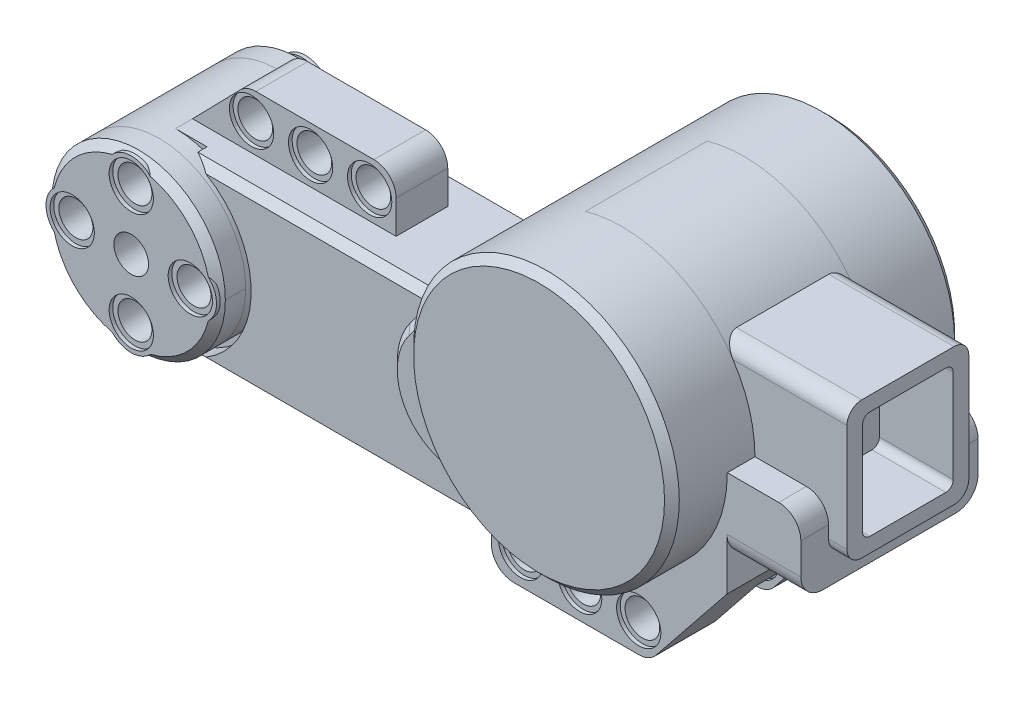
from build123d import *
from build123d.topology import SkipClean

# Parameters (mm, degrees)
BOSS_EXTRUDE1_DEPTH      = 16.1
SKETCH2_R                = 12.5
CUT_EXTRUDE1_DEPTH       = 2.25
CUT_EXTRUDE2_DEPTH       = 2.25
SKETCH5_R                = 2.35
BOSS_EXTRUDE2_DEPTH      = 20
SKETCH6_R                = 18
BOSS_EXTRUDE3_DEPTH      = 7.8
BOSS_EXTRUDE4_START      = 4
SKETCH7_R                = 2.35
BOSS_EXTRUDE4_DEPTH      = 4
BOSS_EXTRUDE5_START      = 7.5
SKETCH8_R                = 18
BOSS_EXTRUDE5_DEPTH      = 7.5
FILLET1_R                = 9
FILLET2_R                = 3
BOSS_EXTRUDE6_DEPTH      = 16.1
FILLET3_R                = 3
CHAMFER1_SIZE            = 1
FILLET4_R                = 3
FILLET5_R                = 3
SKETCH10_W               = 33.097936897
SKETCH10_H               = 7.92
CUT_EXTRUDE3_DEPTH       = 8.1
BOSS_EXTRUDE7_REACH      = 117.391
BOSS_EXTRUDE7_END_RADIUS = 18
BOSS_EXTRUDE8_START      = 2.5
BOSS_EXTRUDE8_DEPTH      = 2.5
SKETCH13_W               = 12.28
SKETCH13_H               = 14.6
CUT_EXTRUDE5_DEPTH       = 10
FILLET6_R                = 1
SKETCH14_R               = 11.75
BOSS_EXTRUDE9_DEPTH      = 6
BOSS_EXTRUDE10_START     = 6
SKETCH15_R               = 11.75
BOSS_EXTRUDE10_DEPTH     = 6
CHAMFER2_SIZE            = 1
SKETCH16_R               = 2.35
CUT_EXTRUDE6_DEPTH       = 109.324095823
SKETCH17_R               = 2.3
CUT_EXTRUDE7_DEPTH       = 5
SKETCH18_R               = 3
CUT_EXTRUDE8_DEPTH       = 0.5
SKETCH19_R               = 3.55
SKETCH19_R_2             = 3
BOSS_EXTRUDE11_DEPTH     = 0.5
BOSS_EXTRUDE12_START     = -0.5
SKETCH20_R               = 3.55
SKETCH20_R_2             = 3
BOSS_EXTRUDE12_DEPTH     = 0.5
CUT_EXTRUDE9_START       = -0.5
SKETCH21_R               = 3
CUT_EXTRUDE9_DEPTH       = 0.5
CUT_EXTRUDE10_START      = -5
SKETCH22_R               = 2.3
CUT_EXTRUDE10_DEPTH      = 5
SKETCH23_R               = 2.35
BOSS_EXTRUDE13_DEPTH     = 3.5
BOSS_EXTRUDE14_START     = 3.5
SKETCH24_R               = 2.35
BOSS_EXTRUDE14_DEPTH     = 3.5
SKETCH25_R               = 3
CUT_EXTRUDE11_DEPTH      = 0.5
CUT_EXTRUDE12_START      = -0.5
SKETCH26_R               = 3
CUT_EXTRUDE12_DEPTH      = 0.5
FILLET7_R                = 3
SKETCH27_R               = 3
CUT_EXTRUDE13_DEPTH      = 0.5
CUT_EXTRUDE14_START      = -0.5
SKETCH28_R               = 3
CUT_EXTRUDE14_DEPTH      = 0.5
SKETCH29_R               = 3
CUT_EXTRUDE15_DEPTH      = 0.5
CUT_EXTRUDE16_START      = -0.5
SKETCH30_R               = 3
CUT_EXTRUDE16_DEPTH      = 0.5


with BuildPart() as part:
    # Sketch1 → Boss-Extrude1 (new body)
    with BuildSketch(Plane.XY):
        with BuildLine():
            Line((0, 0), (44, 0))
            Line((44, 0), (44, 23.5))
            Line((44, 23.5), (0, 23.5))
            ThreePointArc((0, 23.5), (-11.75, 11.75), (0, 0))
        make_face()
    extrude(amount=BOSS_EXTRUDE1_DEPTH)

    # Sketch2 → Cut-Extrude1 (cut)
    with BuildSketch(Plane.XY.offset(16.1)):
        with Locations((0, 11.75)):
            Circle(SKETCH2_R)
    extrude(amount=-CUT_EXTRUDE1_DEPTH, mode=Mode.SUBTRACT)

    # Sketch3 → Cut-Extrude2 (cut)
    with BuildSketch(Plane(origin=(0, 0, 0), x_dir=(-1, 0, 0), z_dir=(0, 0, -1))):
        with BuildLine():
            Line((-4.264680527, 0), (0, 0))
            ThreePointArc((0, 0), (11.75, 11.75), (0, 23.5))
            Line((0, 23.5), (-4.264680527, 23.5))
            ThreePointArc((-4.264680527, 23.5), (-12.5, 11.75), (-4.264680527, 0))
        make_face()
    extrude(amount=-CUT_EXTRUDE2_DEPTH, mode=Mode.SUBTRACT)

    # Sketch5 → Boss-Extrude2 (add)
    with BuildSketch(Plane.XY.offset(16.1)):
        with BuildLine():
            Line((35.5, 7.5), (49.045, 7.5))
            Line((49.045, 7.5), (49.045, -0.6))
            Line((49.045, -0.6), (70.455, -0.6))
            Line((70.455, -0.6), (76.955, 7.5))
            Line((76.955, 7.5), (80.967345679, 12.5))
            Line((80.967345679, 12.5), (80.967345679, 16.5))
            Line((80.967345679, 16.5), (90.967345679, 16.5))
            Line((90.967345679, 16.5), (90.967345679, 26.75))
            Line((90.967345679, 26.75), (81, 26.75))
            ThreePointArc((81, 26.75), (68.611740624, 43.852875991), (48.499070314, 37.414100443))
            Line((48.499070314, 37.414100443), (26.5, 7.5))
            Line((26.5, 7.5), (35.5, 7.5))
        make_face()
        with Locations((61, 3.45)):
            Circle(SKETCH5_R, mode=Mode.SUBTRACT)
        with Locations((69, 3.45)):
            Circle(SKETCH5_R, mode=Mode.SUBTRACT)
        with Locations((53, 3.45)):
            Circle(SKETCH5_R, mode=Mode.SUBTRACT)
    extrude(amount=-BOSS_EXTRUDE2_DEPTH)

    # Sketch6 → Boss-Extrude3 (add)
    with BuildSketch(Plane(origin=(0, 0, -3.9), x_dir=(-1, 0, 0), z_dir=(0, 0, -1))):
        with Locations(Location((-63, 26.75, 0), (0, 0, 180))):
            Circle(SKETCH6_R)
    extrude(amount=BOSS_EXTRUDE3_DEPTH)

    # Sketch7 → Boss-Extrude4 (add)
    with BuildSketch(Plane.XY.offset(16.1).offset(BOSS_EXTRUDE4_START)):
        with BuildLine():
            Line((90.967345679, 26.75), (81, 26.75))
            ThreePointArc((81, 26.75), (68.611740624, 43.852875991), (48.499070314, 37.414100443))
            Line((48.499070314, 37.414100443), (26.5, 7.5))
            Line((26.5, 7.5), (49.045, 7.5))
            Line((49.045, 7.5), (49.045, -0.6))
            Line((49.045, -0.6), (70.455, -0.6))
            Line((70.455, -0.6), (80.967345679, 12.5))
            Line((80.967345679, 12.5), (80.967345679, 16.5))
            Line((80.967345679, 16.5), (90.967345679, 16.5))
            Line((90.967345679, 16.5), (90.967345679, 26.75))
        make_face()
        with Locations((69, 3.45)):
            Circle(SKETCH7_R, mode=Mode.SUBTRACT)
        with Locations((61, 3.45)):
            Circle(SKETCH7_R, mode=Mode.SUBTRACT)
        with Locations((53, 3.45)):
            Circle(SKETCH7_R, mode=Mode.SUBTRACT)
    extrude(amount=-BOSS_EXTRUDE4_DEPTH)

    # Sketch8 → Boss-Extrude5 (add)
    with BuildSketch(Plane.XY.offset(20.1).offset(BOSS_EXTRUDE5_START)):
        with Locations((63, 26.75)):
            Circle(SKETCH8_R)
    extrude(amount=-BOSS_EXTRUDE5_DEPTH)

    # Fillet1
    fillet1_edges = [part.edges().sort_by_distance(p)[0] for p in [
        (26.5, 7.5, 18.1),
    ]]
    fillet(fillet1_edges, radius=FILLET1_R)

    # Fillet2
    fillet2_edges = [part.edges().sort_by_distance(p)[0] for p in [
        (70.455, -0.6, 6.1),
        (49.045, -0.6, 6.1),
    ]]
    fillet(fillet2_edges, radius=FILLET2_R)

    # Sketch9 → Boss-Extrude6 (add)
    with BuildSketch(Plane(origin=(0, 0, 0), x_dir=(-1, 0, 0), z_dir=(0, 0, -1))):
        Polygon((-44, 0), (-49.045, 7.5), (-44, 9.048717535), align=None)
    extrude(amount=-BOSS_EXTRUDE6_DEPTH)

    # Fillet3
    fillet3_edges = [part.edges().sort_by_distance(p)[0] for p in [
        (44, 0, 8.05),
    ]]
    fillet(fillet3_edges, radius=FILLET3_R)

    # Chamfer1
    # the kernel refuses this chamfer: 1 mm, written as the material it takes off along each edge
    with BuildSketch(Plane(origin=(63, 26.75, 27.6), x_dir=(1, 0, 0), z_dir=(0, -1, 0))) as chamfer1_piece_1:
        Polygon((18, -CHAMFER1_SIZE), (18 - CHAMFER1_SIZE, 0), (18, 0), align=None)
    revolve(axis=Axis((63, 26.75, 27.6), (0, 0, 1)), mode=Mode.SUBTRACT)
    with BuildSketch(Plane(origin=(44.290369968, 7.5, -3.9), x_dir=(0, 0.9996219169112968, -0.02749587661058651), z_dir=(1, 0, 0))) as chamfer1_piece_2:
        Polygon((CHAMFER1_SIZE * 0.999621916911, CHAMFER1_SIZE * 0.0274958766106), (-CHAMFER1_SIZE * 0.0274958766106, CHAMFER1_SIZE * 0.999621916911), (0, 0), align=None)
    extrude(amount=4.754630032, mode=Mode.SUBTRACT)
    with BuildSketch(Plane(origin=(44.290369968, 7.5, 20.1), x_dir=(0, 0.9996219169112968, 0.027495876610585647), z_dir=(1, 0, 0))) as chamfer1_piece_3:
        Polygon((CHAMFER1_SIZE * 0.999621916911, -CHAMFER1_SIZE * 0.0274958766106), (-CHAMFER1_SIZE * 0.0274958766106, -CHAMFER1_SIZE * 0.999621916911), (0, 0), align=None)
    extrude(amount=4.754630032, mode=Mode.SUBTRACT)
    with BuildSketch(Plane(origin=(44.290369968, 16.5, -3.9), x_dir=(-0.8056072047544376, 0.5924500245993257, 0), z_dir=(0.5924500245993257, 0.8056072047544376, 0))) as chamfer1_piece_4:
        Polygon((9 - CHAMFER1_SIZE, 0), (9, CHAMFER1_SIZE), (9, 0), align=None)
    revolve(axis=Axis((44.290369968, 16.5, -3.9), (0, 0, 1)), revolution_arc=126.331062822, mode=Mode.SUBTRACT)
    with BuildSketch(Plane(origin=(44.290369968, 16.5, 20.1), x_dir=(-0.8056072047544383, 0.5924500245993248, 0), z_dir=(0.5924500245993248, 0.8056072047544383, 0))) as chamfer1_piece_5:
        Polygon((9 - CHAMFER1_SIZE, 0), (9, -CHAMFER1_SIZE), (9, 0), align=None)
    revolve(axis=Axis((44.290369968, 16.5, 20.1), (0, 0, 1)), revolution_arc=126.331062822, mode=Mode.SUBTRACT)
    with BuildSketch(Plane(origin=(1.692997539, 0, 16.1), x_dir=(0, 0.9996219169112968, 0.02749587661058563), z_dir=(1, 0, 0)), Plane(origin=(1.692997539, 0, 0), x_dir=(0, -0.027495876610586372, 0.9996219169112968), z_dir=(1, 0, 0))) as chamfer1_piece_6:
        Polygon((CHAMFER1_SIZE * 0.999621916911, -CHAMFER1_SIZE * 0.0274958766106), (-CHAMFER1_SIZE * 0.0274958766106, -CHAMFER1_SIZE * 0.999621916911), (0, 0), align=None)
    extrude(amount=40.709435562, mode=Mode.SUBTRACT)
    with BuildSketch(Plane(origin=(44.891669299, 1.325573784, 0), x_dir=(0.02281457711602184, -0.015346605540044031, 0.9996219169112968), z_dir=(0.5581420718965207, 0.829745399251517, 0))) as chamfer1_piece_7_section:
        Polygon((CHAMFER1_SIZE * 0.999621916911, -CHAMFER1_SIZE * 0.0274958766106), (-CHAMFER1_SIZE * 0.0274958766106, -CHAMFER1_SIZE * 0.999621916911), (0, 0), align=None)
    chamfer1_piece_7 = extrude(amount=10.013033336, mode=Mode.PRIVATE)
    chamfer1_piece_7 = split(chamfer1_piece_7, bisect_by=Plane(origin=(46.990956346, 7.5, 0.346010194), z_dir=(0, -1, 0)), keep=Keep.TOP, mode=Mode.PRIVATE)
    add(chamfer1_piece_7, mode=Mode.SUBTRACT)
    with BuildSketch(Plane(origin=(44.891669299, 1.325573784, 16.1), x_dir=(0.02281457711602186, -0.015346605540044045, -0.9996219169112968), z_dir=(0.5581420718965207, 0.829745399251517, 0))) as chamfer1_piece_8_section:
        Polygon((CHAMFER1_SIZE * 0.999621916911, CHAMFER1_SIZE * 0.0274958766106), (-CHAMFER1_SIZE * 0.0274958766106, CHAMFER1_SIZE * 0.999621916911), (0, 0), align=None)
    chamfer1_piece_8 = extrude(amount=10.013033336, mode=Mode.PRIVATE)
    chamfer1_piece_8 = split(chamfer1_piece_8, bisect_by=Plane(origin=(46.990956346, 7.5, 15.753989806), z_dir=(0, -1, 0)), keep=Keep.TOP, mode=Mode.PRIVATE)
    add(chamfer1_piece_8, mode=Mode.SUBTRACT)
    with BuildSketch(Plane(origin=(42.402433101, 3, 0), x_dir=(0.8297453992515168, -0.5581420718965208, 0), z_dir=(0.5581420718965208, 0.8297453992515168, 0))) as chamfer1_piece_9:
        Polygon((3, -CHAMFER1_SIZE), (3 - CHAMFER1_SIZE, 0), (3, 0), align=None)
    revolve(axis=Axis((42.402433101, 3, 0), (0, 0, -1)), revolution_arc=56.072593229, mode=Mode.SUBTRACT)
    with BuildSketch(Plane(origin=(42.402433101, 3, 16.1), x_dir=(0.8297453992515168, -0.5581420718965208, 0), z_dir=(0.5581420718965208, 0.8297453992515168, 0))) as chamfer1_piece_10:
        Polygon((3 - CHAMFER1_SIZE, 0), (3, CHAMFER1_SIZE), (3, 0), align=None)
    revolve(axis=Axis((42.402433101, 3, 16.1), (0, 0, -1)), revolution_arc=56.072593229, mode=Mode.SUBTRACT)
    with BuildSketch(Plane(origin=(40.83821181, 23.5, 0), x_dir=(0, 0.02749587661058563, 0.9996219169112968), z_dir=(-1, 0, 0))) as chamfer1_piece_11_section:
        Polygon((CHAMFER1_SIZE * 0.999621916911, -CHAMFER1_SIZE * 0.0274958766106), (-CHAMFER1_SIZE * 0.0274958766106, -CHAMFER1_SIZE * 0.999621916911), (0, 0), align=None)
    chamfer1_piece_11 = extrude(amount=39.14521427, mode=Mode.PRIVATE)
    chamfer1_piece_11 = split(chamfer1_piece_11, bisect_by=Plane(origin=(32.237492619, 15.301781077, 0.335802293), z_dir=(-0.8056072047544383, 0.5924500245993248, 0)), keep=Keep.TOP, mode=Mode.PRIVATE)
    add(chamfer1_piece_11, mode=Mode.SUBTRACT)
    with BuildSketch(Plane(origin=(40.83821181, 23.5, 16.1), x_dir=(0, -0.9996219169112968, 0.027495876610585647), z_dir=(-1, 0, 0))) as chamfer1_piece_12_section:
        Polygon((CHAMFER1_SIZE * 0.999621916911, -CHAMFER1_SIZE * 0.0274958766106), (-CHAMFER1_SIZE * 0.0274958766106, -CHAMFER1_SIZE * 0.999621916911), (0, 0), align=None)
    chamfer1_piece_12 = extrude(amount=39.14521427, mode=Mode.PRIVATE)
    chamfer1_piece_12 = split(chamfer1_piece_12, bisect_by=Plane(origin=(32.237492621, 15.301781079, 15.764197707), z_dir=(-0.8056072047544383, 0.5924500245993248, 0)), keep=Keep.TOP, mode=Mode.PRIVATE)
    add(chamfer1_piece_12, mode=Mode.SUBTRACT)
    with BuildSketch(Plane(origin=(50.022663964, 39.485866786, -3.9), x_dir=(-0.0221508762985308, 0.016289932774324382, 0.9996219169112965), z_dir=(-0.5924500245993248, -0.8056072047544383, 0))) as chamfer1_piece_13_section:
        Polygon((CHAMFER1_SIZE * 0.999621916911, -CHAMFER1_SIZE * 0.0274958766106), (-CHAMFER1_SIZE * 0.0274958766106, -CHAMFER1_SIZE * 0.999621916911), (0, 0), align=None)
    chamfer1_piece_13 = extrude(amount=21.913677609, mode=Mode.PRIVATE)
    chamfer1_piece_13 = chamfer1_piece_13 - Plane(origin=(63, 26.75, -3.548356568), x_dir=(1, 0, 0), z_dir=(0, 0, 1)) * Cylinder(18, 48, mode=Mode.PRIVATE)
    add(chamfer1_piece_13, mode=Mode.SUBTRACT)
    with BuildSketch(Plane(origin=(63, 26.75, -11.7), x_dir=(1, 0, 0), z_dir=(0, 1, 0))) as chamfer1_piece_14:
        Polygon((18, -CHAMFER1_SIZE), (18 - CHAMFER1_SIZE, 0), (18, 0), align=None)
    revolve(axis=Axis((63, 26.75, -11.7), (0, 0, -1)), mode=Mode.SUBTRACT)
    with BuildSketch(Plane(origin=(50.022663964, 39.485866786, 20.1), x_dir=(-0.022150876298526342, 0.016289932774321097, -0.9996219169112968), z_dir=(-0.5924500245993248, -0.8056072047544384, 0))) as chamfer1_piece_15_section:
        Polygon((CHAMFER1_SIZE * 0.999621916911, CHAMFER1_SIZE * 0.0274958766106), (-CHAMFER1_SIZE * 0.0274958766106, CHAMFER1_SIZE * 0.999621916911), (0, 0), align=None)
    chamfer1_piece_15 = extrude(amount=21.913677609, mode=Mode.PRIVATE)
    chamfer1_piece_15 = chamfer1_piece_15 - Plane(origin=(63, 26.75, 19.748356568), x_dir=(1, 0, 0), z_dir=(0, 0, 1)) * Cylinder(18, 48, mode=Mode.PRIVATE)
    add(chamfer1_piece_15, mode=Mode.SUBTRACT)

    # Fillet4
    fillet4_edges = [part.edges().sort_by_distance(p)[0] for p in [
        (90.967345679, 26.75, 8.1),
    ]]
    fillet(fillet4_edges, radius=FILLET4_R)

    # Fillet5
    fillet5_edges = [part.edges().sort_by_distance(p)[0] for p in [
        (85.967345679, 16.5, -3.9),
        (85.967345679, 16.5, 20.1),
    ]]
    fillet(fillet5_edges, radius=FILLET5_R)

    # Sketch10 → Cut-Extrude3 (cut)
    with BuildSketch(Plane.XZ.offset(0.6)):
        with Locations((65.593968448, 8.05)):
            Rectangle(SKETCH10_W, SKETCH10_H)
    extrude(amount=-CUT_EXTRUDE3_DEPTH, mode=Mode.SUBTRACT)

    # Boss-Extrude7: up to this cylinder (the profile starts outside it)
    boss_extrude7_end = Plane(origin=(63, 26.75, 8.1), z_dir=(0, 0, 1)) * Cylinder(BOSS_EXTRUDE7_END_RADIUS, 271.782, mode=Mode.PRIVATE)
    # Sketch11 → Boss-Extrude7 (add, up to the surface)
    with BuildSketch(Plane(origin=(90.967345679, 0, 0), x_dir=(0, 0, -1), z_dir=(1, 0, 0)), mode=Mode.PRIVATE) as boss_extrude7_sk1:
        with BuildLine():
            Line((-14.35, 20.1), (-1.85, 20.1))
            ThreePointArc((-1.85, 20.1), (-0.435786438, 20.685786438), (0.15, 22.1))
            Line((0.15, 22.1), (0.15, 36.66))
            ThreePointArc((0.15, 36.66), (-0.435786438, 38.074213562), (-1.85, 38.66))
            Line((-1.85, 38.66), (-14.35, 38.66))
            ThreePointArc((-14.35, 38.66), (-15.764213562, 38.074213562), (-16.35, 36.66))
            Line((-16.35, 36.66), (-16.35, 22.1))
            ThreePointArc((-16.35, 22.1), (-15.764213562, 20.685786438), (-14.35, 20.1))
        make_face()
    boss_extrude7_tool1 = extrude(boss_extrude7_sk1.sketch, amount=-BOSS_EXTRUDE7_REACH, mode=Mode.PRIVATE) - boss_extrude7_end
    add(boss_extrude7_tool1.solids().sort_by_distance((90.967346, 29.38, 8.1))[0])

    # Sketch12 → Boss-Extrude8 (add)
    with BuildSketch(Plane(origin=(90.967345679, 0, 0), x_dir=(0, 0, -1), z_dir=(1, 0, 0)).offset(BOSS_EXTRUDE8_START)):
        with BuildLine():
            Line((-14.35, 20.1), (-1.85, 20.1))
            ThreePointArc((-1.85, 20.1), (-0.435786438, 20.685786438), (0.15, 22.1))
            Line((0.15, 22.1), (0.15, 36.66))
            ThreePointArc((0.15, 36.66), (-0.435786438, 38.074213562), (-1.85, 38.66))
            Line((-1.85, 38.66), (-14.35, 38.66))
            ThreePointArc((-14.35, 38.66), (-15.764213562, 38.074213562), (-16.35, 36.66))
            Line((-16.35, 36.66), (-16.35, 22.1))
            ThreePointArc((-16.35, 22.1), (-15.764213562, 20.685786438), (-14.35, 20.1))
        make_face()
    extrude(amount=-BOSS_EXTRUDE8_DEPTH)

    # Sketch13 → Cut-Extrude5 (cut)
    with BuildSketch(Plane(origin=(93.467345679, 0, 0), x_dir=(0, 0, -1), z_dir=(1, 0, 0))):
        with Locations((-8.1, 29.4)):
            Rectangle(SKETCH13_W, SKETCH13_H)
    extrude(amount=-CUT_EXTRUDE5_DEPTH, mode=Mode.SUBTRACT)

    # Fillet6
    fillet6_edges = [part.edges().sort_by_distance(p)[0] for p in [
        (88.467345679, 22.1, 14.24),
        (88.467345679, 36.7, 14.24),
        (88.467345679, 36.7, 1.96),
        (88.467345679, 22.1, 1.96),
    ]]
    fillet(fillet6_edges, radius=FILLET6_R)

    # Sketch14 → Boss-Extrude9 (add)
    with BuildSketch(Plane.XY.offset(13.85)):
        with Locations(Location((0, 11.75, 0), (0, 0, 270))):
            Circle(SKETCH14_R)
    extrude(amount=BOSS_EXTRUDE9_DEPTH)

    # Sketch15 → Boss-Extrude10 (add)
    with SkipClean():  # the faces are left unmerged after this step: merging them gives an invalid solid
        with BuildSketch(Plane(origin=(0, 0, 2.25), x_dir=(-1, 0, 0), z_dir=(0, 0, -1)).offset(BOSS_EXTRUDE10_START)):
            with Locations((0, 11.75)):
                Circle(SKETCH15_R)
        extrude(amount=-BOSS_EXTRUDE10_DEPTH)
    add(part.part.scale(1), mode=Mode.REPLACE)  # the faces are merged on a copy

    # Chamfer2
    chamfer2_edges = [part.edges().sort_by_distance(p)[0] for p in [
        (0, 23.5, 19.85),
        (11.75, 11.75, -3.75),
    ]]
    chamfer(chamfer2_edges, length=CHAMFER2_SIZE)

    # Sketch16 → Cut-Extrude6 (cut, through all)
    with BuildSketch(Plane.XY.offset(19.85)):
        with Locations((0, 11.75)):
            Circle(SKETCH16_R)
    extrude(amount=-CUT_EXTRUDE6_DEPTH, mode=Mode.SUBTRACT)

    # Sketch17 → Cut-Extrude7 (cut)
    with BuildSketch(Plane.XY.offset(19.85)):
        with Locations((8, 11.75)):
            Circle(SKETCH17_R)
        with Locations((0, 3.75)):
            Circle(SKETCH17_R)
        with Locations((-8, 11.75)):
            Circle(SKETCH17_R)
        with Locations((0, 19.75)):
            Circle(SKETCH17_R)
    extrude(amount=-CUT_EXTRUDE7_DEPTH, mode=Mode.SUBTRACT)

    # Sketch18 → Cut-Extrude8 (cut)
    with BuildSketch(Plane.XY.offset(19.85)):
        with Locations((8, 11.75)):
            Circle(SKETCH18_R)
        with Locations((0, 19.75)):
            Circle(SKETCH18_R)
        with Locations((-8, 11.75)):
            Circle(SKETCH18_R)
        with Locations((0, 3.75)):
            Circle(SKETCH18_R)
    extrude(amount=-CUT_EXTRUDE8_DEPTH, mode=Mode.SUBTRACT)

    # Sketch19 → Boss-Extrude11 (add)
    # profile 1 of 4: a face of its own
    with BuildSketch(Plane.XY.offset(19.85)):
        with Locations((0, 19.75)):
            Circle(SKETCH19_R)
        with Locations((0, 19.75)):
            Circle(SKETCH19_R_2, mode=Mode.SUBTRACT)
    # profile 2 of 4: a face of its own
    with BuildSketch(Plane.XY.offset(19.85)):
        with Locations((-8, 11.75)):
            Circle(SKETCH19_R)
        with Locations((-8, 11.75)):
            Circle(SKETCH19_R_2, mode=Mode.SUBTRACT)
    # profile 3 of 4: a face of its own
    with BuildSketch(Plane.XY.offset(19.85)):
        with Locations((8, 11.75)):
            Circle(SKETCH19_R)
        with BuildLine():
            ThreePointArc((10.66015625, 13.136927801), (5, 11.75), (10.66015625, 10.363072199))
            ThreePointArc((10.66015625, 10.363072199), (11, 11.75), (10.66015625, 13.136927801))
        make_face(mode=Mode.SUBTRACT)
    # profile 4 of 4: a face of its own
    with BuildSketch(Plane.XY.offset(19.85)):
        with Locations((0, 3.75)):
            Circle(SKETCH19_R)
        with Locations((0, 3.75)):
            Circle(SKETCH19_R_2, mode=Mode.SUBTRACT)
    extrude(amount=-BOSS_EXTRUDE11_DEPTH)

    # Sketch20 → Boss-Extrude12 (add)
    # profile 1 of 4: a face of its own
    with BuildSketch(Plane(origin=(0, 0, -3.75), x_dir=(-1, 0, 0), z_dir=(0, 0, -1)).offset(BOSS_EXTRUDE12_START)):
        with Locations((0, 3.75)):
            Circle(SKETCH20_R)
        with Locations(Location((0, 3.75, 0), (0, 0, 180))):
            Circle(SKETCH20_R_2, mode=Mode.SUBTRACT)
    # profile 2 of 4: a face of its own
    with BuildSketch(Plane(origin=(0, 0, -3.75), x_dir=(-1, 0, 0), z_dir=(0, 0, -1)).offset(BOSS_EXTRUDE12_START)):
        with Locations((-8, 11.75)):
            Circle(SKETCH20_R)
        with BuildLine():
            ThreePointArc((-10.66015625, 10.363072199), (-5, 11.75), (-10.66015625, 13.136927801))
            ThreePointArc((-10.66015625, 13.136927801), (-11, 11.75), (-10.66015625, 10.363072199))
        make_face(mode=Mode.SUBTRACT)
    # profile 3 of 4: a face of its own
    with BuildSketch(Plane(origin=(0, 0, -3.75), x_dir=(-1, 0, 0), z_dir=(0, 0, -1)).offset(BOSS_EXTRUDE12_START)):
        with Locations((0, 19.75)):
            Circle(SKETCH20_R)
        with Locations(Location((0, 19.75, 0), (0, 0, 180))):
            Circle(SKETCH20_R_2, mode=Mode.SUBTRACT)
    # profile 4 of 4: a face of its own
    with BuildSketch(Plane(origin=(0, 0, -3.75), x_dir=(-1, 0, 0), z_dir=(0, 0, -1)).offset(BOSS_EXTRUDE12_START)):
        with Locations((8, 11.75)):
            Circle(SKETCH20_R)
        with Locations(Location((8, 11.75, 0), (0, 0, 180))):
            Circle(SKETCH20_R_2, mode=Mode.SUBTRACT)
    extrude(amount=BOSS_EXTRUDE12_DEPTH)

    # Sketch21 → Cut-Extrude9 (cut)
    with BuildSketch(Plane(origin=(0, 0, -3.75), x_dir=(-1, 0, 0), z_dir=(0, 0, -1)).offset(CUT_EXTRUDE9_START)):
        with Locations(Location((0, 3.75, 0), (0, 0, 180))):
            Circle(SKETCH21_R)
        with Locations(Location((8, 11.75, 0), (0, 0, 180))):
            Circle(SKETCH21_R)
        with Locations(Location((-8, 11.75, 0), (0, 0, 180))):
            Circle(SKETCH21_R)
        with Locations(Location((0, 19.75, 0), (0, 0, 180))):
            Circle(SKETCH21_R)
    extrude(amount=CUT_EXTRUDE9_DEPTH, mode=Mode.SUBTRACT)

    # Sketch22 → Cut-Extrude10 (cut)
    with BuildSketch(Plane(origin=(0, 0, -3.75), x_dir=(-1, 0, 0), z_dir=(0, 0, -1)).offset(CUT_EXTRUDE10_START)):
        with Locations(Location((0, 3.75, 0), (0, 0, 180))):
            Circle(SKETCH22_R)
        with Locations(Location((8, 11.75, 0), (0, 0, 180))):
            Circle(SKETCH22_R)
        with Locations(Location((0, 19.75, 0), (0, 0, 180))):
            Circle(SKETCH22_R)
        with Locations(Location((-8, 11.75, 0), (0, 0, 180))):
            Circle(SKETCH22_R)
    extrude(amount=CUT_EXTRUDE10_DEPTH, mode=Mode.SUBTRACT)

    # Sketch23 → Boss-Extrude13 (add)
    with BuildSketch(Plane.XY.offset(8.05)):
        Polygon((7.32, 23.5), (27.58, 23.5), (27.58, 31), (7.32, 31), (0, 23.5), align=None)
        with Locations((8, 27.25)):
            Circle(SKETCH23_R, mode=Mode.SUBTRACT)
        with Locations((16, 27.25)):
            Circle(SKETCH23_R, mode=Mode.SUBTRACT)
        with Locations((24, 27.25)):
            Circle(SKETCH23_R, mode=Mode.SUBTRACT)
    extrude(amount=BOSS_EXTRUDE13_DEPTH)

    # Sketch24 → Boss-Extrude14 (add)
    with BuildSketch(Plane(origin=(0, 0, 8.05), x_dir=(-1, 0, 0), z_dir=(0, 0, -1)).offset(BOSS_EXTRUDE14_START)):
        Polygon((-27.58, 23.5), (0, 23.5), (-7.32, 31), (-27.58, 31), align=None)
        with Locations((-8, 27.25)):
            Circle(SKETCH24_R, mode=Mode.SUBTRACT)
        with Locations((-16, 27.25)):
            Circle(SKETCH24_R, mode=Mode.SUBTRACT)
        with Locations((-24, 27.25)):
            Circle(SKETCH24_R, mode=Mode.SUBTRACT)
    extrude(amount=-BOSS_EXTRUDE14_DEPTH)

    # Sketch25 → Cut-Extrude11 (cut)
    with BuildSketch(Plane.XY.offset(11.55)):
        with Locations((16, 27.25)):
            Circle(SKETCH25_R)
        with Locations((24, 27.25)):
            Circle(SKETCH25_R)
        with Locations((8, 27.25)):
            Circle(SKETCH25_R)
    extrude(amount=-CUT_EXTRUDE11_DEPTH, mode=Mode.SUBTRACT)

    # Sketch26 → Cut-Extrude12 (cut)
    with BuildSketch(Plane(origin=(0, 0, 4.55), x_dir=(-1, 0, 0), z_dir=(0, 0, -1)).offset(CUT_EXTRUDE12_START)):
        with Locations(Location((-24, 27.25, 0), (0, 0, 180))):
            Circle(SKETCH26_R)
        with Locations(Location((-16, 27.25, 0), (0, 0, 180))):
            Circle(SKETCH26_R)
        with Locations(Location((-8, 27.25, 0), (0, 0, 180))):
            Circle(SKETCH26_R)
    extrude(amount=CUT_EXTRUDE12_DEPTH, mode=Mode.SUBTRACT)

    # Fillet7
    fillet7_edges = [part.edges().sort_by_distance(p)[0] for p in [
        (27.58, 31, 6.3),
        (7.32, 31, 6.3),
    ]]
    fillet(fillet7_edges, radius=FILLET7_R)

    # Sketch27 → Cut-Extrude13 (cut)
    with BuildSketch(Plane.XY.offset(20.1)):
        with Locations((53, 3.45)):
            Circle(SKETCH27_R)
        with Locations((61, 3.45)):
            Circle(SKETCH27_R)
        with Locations((69, 3.45)):
            Circle(SKETCH27_R)
    extrude(amount=-CUT_EXTRUDE13_DEPTH, mode=Mode.SUBTRACT)

    # Sketch28 → Cut-Extrude14 (cut)
    with BuildSketch(Plane(origin=(0, 0, 12.01), x_dir=(-1, 0, 0), z_dir=(0, 0, -1)).offset(CUT_EXTRUDE14_START)):
        with Locations(Location((-69, 3.45, 0), (0, 0, 180))):
            Circle(SKETCH28_R)
        with Locations(Location((-61, 3.45, 0), (0, 0, 180))):
            Circle(SKETCH28_R)
        with Locations(Location((-53, 3.45, 0), (0, 0, 180))):
            Circle(SKETCH28_R)
    extrude(amount=CUT_EXTRUDE14_DEPTH, mode=Mode.SUBTRACT)

    # Sketch29 → Cut-Extrude15 (cut)
    with BuildSketch(Plane.XY.offset(4.09)):
        with Locations((69, 3.45)):
            Circle(SKETCH29_R)
        with Locations((61, 3.45)):
            Circle(SKETCH29_R)
        with Locations((53, 3.45)):
            Circle(SKETCH29_R)
    extrude(amount=-CUT_EXTRUDE15_DEPTH, mode=Mode.SUBTRACT)

    # Sketch30 → Cut-Extrude16 (cut)
    with BuildSketch(Plane(origin=(0, 0, -3.9), x_dir=(-1, 0, 0), z_dir=(0, 0, -1)).offset(CUT_EXTRUDE16_START)):
        with Locations(Location((-53, 3.45, 0), (0, 0, 180))):
            Circle(SKETCH30_R)
        with Locations(Location((-61, 3.45, 0), (0, 0, 180))):
            Circle(SKETCH30_R)
        with Locations(Location((-69, 3.45, 0), (0, 0, 180))):
            Circle(SKETCH30_R)
    extrude(amount=CUT_EXTRUDE16_DEPTH, mode=Mode.SUBTRACT)


solid = part.part
